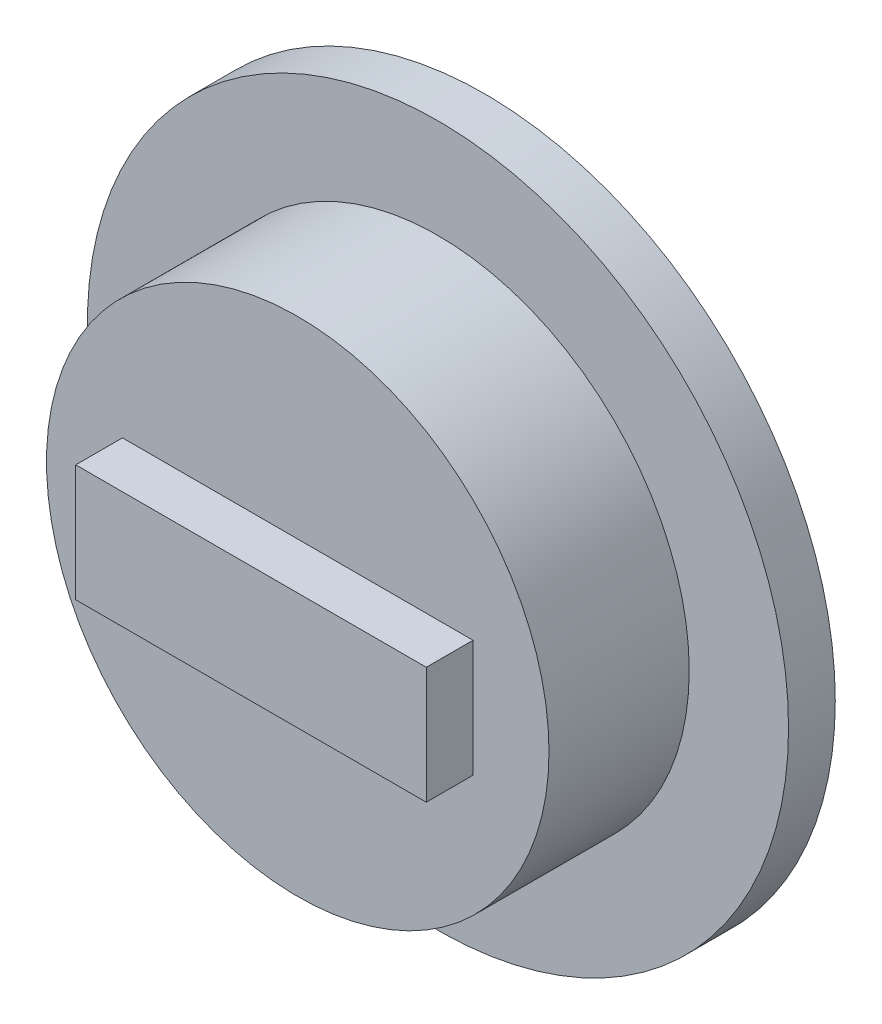
from build123d import *

# Parameters (mm, degrees)
SKETCH_1_R          = 15
EXTRUDE_1_DEPTH     = 2
EXTRUDE_START       = 2
SKETCH_2_R          = 10.75
EXTRUDE_2_DEPTH     = 6
SKETCH_3_W          = 15
SKETCH_3_H          = 5
EXTRUDE_3_DEPTH     = 10
SKETCH_4_W          = 15
SKETCH_4_H          = 4
CUT_EXTRUDE_1_DEPTH = 4


with BuildPart() as part:
    # Эскиз1 → Бобышка-Вытянуть1 (new body)
    with BuildSketch(Plane.XY):
        Circle(SKETCH_1_R)
    extrude(amount=EXTRUDE_1_DEPTH)

    # Эскиз2 → Бобышка-Вытянуть2 (add)
    with BuildSketch(Plane.XY.offset(EXTRUDE_START)):
        Circle(SKETCH_2_R)
    extrude(amount=EXTRUDE_2_DEPTH)

    # Эскиз3 → Бобышка-Вытянуть3 (add)
    with BuildSketch(Plane.XY):
        Rectangle(SKETCH_3_W, SKETCH_3_H)
    extrude(amount=EXTRUDE_3_DEPTH)

    # Эскиз4 → Вырез-Вытянуть1 (cut)
    with BuildSketch(Plane.XY):
        with Locations((0, 4)):
            Rectangle(SKETCH_4_W, SKETCH_4_H)
        with Locations((0, -4)):
            Rectangle(SKETCH_4_W, SKETCH_4_H)
    extrude(amount=CUT_EXTRUDE_1_DEPTH, mode=Mode.SUBTRACT)


solid = part.part
